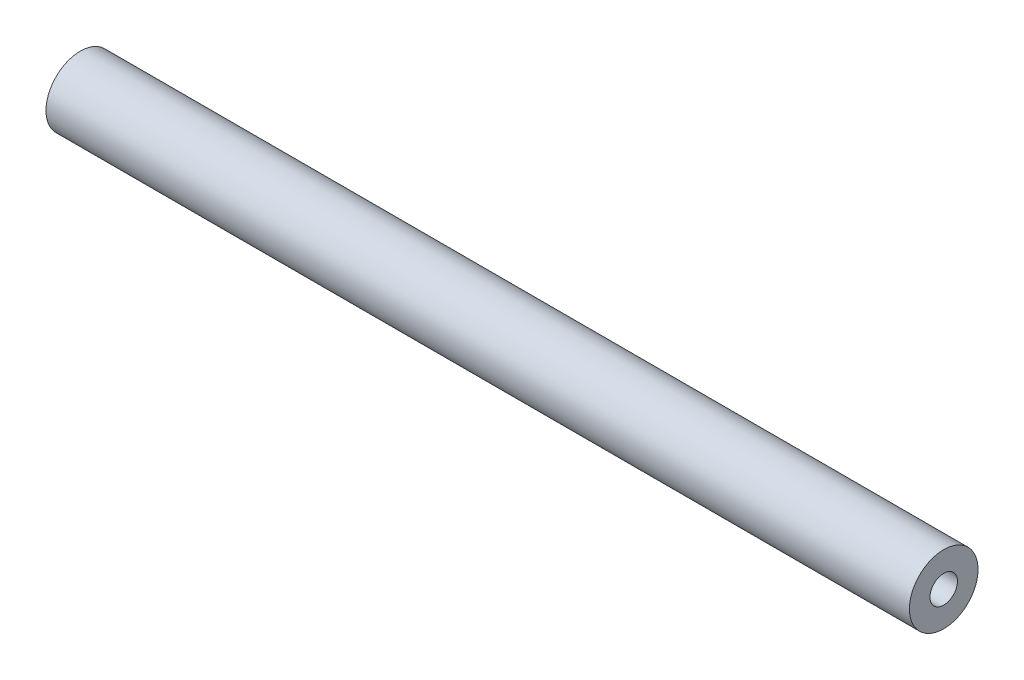
from build123d import *

# Parameters (mm, degrees)
SKETCH1_R           = 31.75
SKETCH1_R_2         = 12.7
BOSS_EXTRUDE1_DEPTH = 399.25625


with BuildPart() as part:
    # Sketch1 → Boss-Extrude1 (new, symmetric)
    with BuildSketch(Plane(origin=(0, 0, 0), x_dir=(0, 0, -1), z_dir=(1, 0, 0))):
        Circle(SKETCH1_R)
        Circle(SKETCH1_R_2, mode=Mode.SUBTRACT)
    extrude(amount=BOSS_EXTRUDE1_DEPTH, both=True)


solid = part.part
